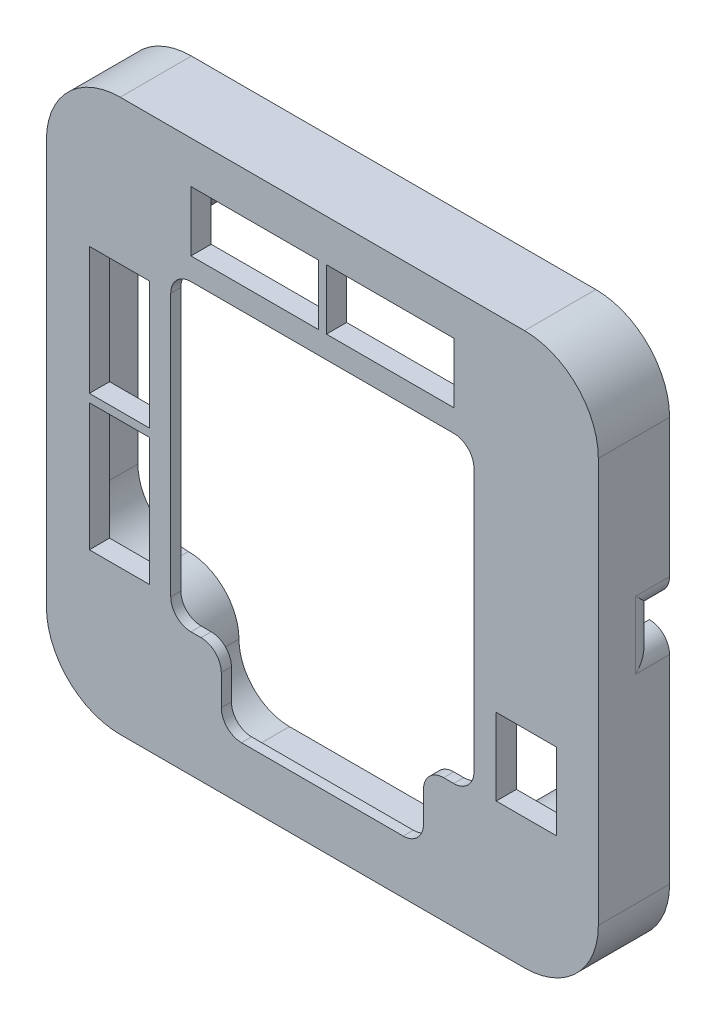
from build123d import *

# Parameters (mm, degrees)
WALL_EXTRUDE_BOSS_START          = 8.64
WALL_EXTRUDE_BOSS_DEPTH          = 7.05
CEILING_EXTRUDE_BOSS_DEPTH       = 2
SCREWS_BLOCKS_EXTRUDE_BOSS_DEPTH = 5.05
SCREWS_BLOCKS_FILLET_R           = 5
NUTS_EXTRUDE_DEPTH               = 3.2
SCREWS_SKETCH_R                  = 2.15
SCREWS_HOOLES_EXTRUDE_DEPTH      = 2.5
CONNECTORS_SKETCH_W              = 12.6
CONNECTORS_SKETCH_H              = 5.95
CONNECTORS_SKETCH_W_2            = 5.95
CONNECTORS_SKETCH_H_2            = 12.6
CONNECTORS_SKETCH_H_3            = 7.6
CONNECTORS_EXTRUDE_DEPTH         = 2.5
SWITCH_SKETCH_W                  = 1.4
SWITCH_SKETCH_H                  = 2.68
SWITCH_EXTRUDE_DEPTH             = 2.5
SWITCH_FILLET_R                  = 2
GLASS_EXTRUDE_DEPTH              = 2.5
GLASS_FIT_EXTRUDE_DEPTH          = 1


with BuildPart() as part:
    # Wall_Sketch → Wall_Extrude_Boss (new body)
    with BuildSketch(Plane.XY.offset(WALL_EXTRUDE_BOSS_START)):
        with BuildLine():
            Line((-52.3, 44.999999897), (-52.29999, 5.00000605))
            ThreePointArc((-52.29999, 5.00000605), (-50.161874571, -0.161870293), (-45, -2.29999))
            Line((-45, -2.29999), (-5.000000575, -2.3))
            ThreePointArc((-5.000000575, -2.3), (0.161879299, -0.161879706), (2.3, 5))
            Line((2.3, 5), (2.3, 45))
            ThreePointArc((2.3, 45), (0.161879503, 50.161879503), (-5, 52.3))
            Line((-5, 52.3), (-45, 52.3))
            ThreePointArc((-45, 52.3), (-50.161879539, 50.161879466), (-52.3, 44.999999897))
        make_face()
        with BuildLine():
            Line((-5, 50.3), (-45, 50.3))
            ThreePointArc((-45, 50.3), (-48.747665967, 48.747665914), (-50.3, 44.999999925))
            Line((-50.3, 44.999999925), (-50.29999, 5.00000655))
            ThreePointArc((-50.29999, 5.00000655), (-48.747661185, 1.252343447), (-45, -0.29999))
            Line((-45, -0.29999), (-5.000000075, -0.3))
            ThreePointArc((-5.000000075, -0.3), (-1.252334086, 1.252334033), (0.3, 5))
            Line((0.3, 5), (0.3, 45))
            ThreePointArc((0.3, 45), (-1.25233406, 48.74766594), (-5, 50.3))
        make_face(mode=Mode.SUBTRACT)
    extrude(amount=-WALL_EXTRUDE_BOSS_DEPTH)

    # Ceiling_Sketch → Ceiling_Extrude_Boss (add)
    with BuildSketch(Plane.XY.offset(8.64)):
        with BuildLine():
            Line((-45, -0.29999), (-5.000000075, -0.3))
            ThreePointArc((-5.000000075, -0.3), (-1.252334086, 1.252334033), (0.3, 5))
            Line((0.3, 5), (0.3, 45))
            ThreePointArc((0.3, 45), (-1.25233406, 48.74766594), (-5, 50.3))
            Line((-5, 50.3), (-45, 50.3))
            ThreePointArc((-45, 50.3), (-48.747665967, 48.747665914), (-50.3, 44.999999925))
            Line((-50.3, 44.999999925), (-50.29999, 5.00000655))
            ThreePointArc((-50.29999, 5.00000655), (-48.747661185, 1.252343447), (-45, -0.29999))
        make_face()
    extrude(amount=-CEILING_EXTRUDE_BOSS_DEPTH)


with BuildPart() as screws_blocks_extrude_boss_tool:
    # Screws_Blocks_Sketch → Screws_Blocks_Extrude_Boss (new body)
    with BuildSketch(Plane(origin=(0, 0, 6.64), x_dir=(-1, 0, 0), z_dir=(0, 0, -1))):
        with BuildLine():
            Line((9.7, -0.299998825), (4.7, -0.299998825))
            ThreePointArc((4.7, -0.299998825), (1.164466094, 1.164467269), (-0.3, 4.700001175))
            Line((-0.3, 4.700001175), (-0.3, 9.700001175))
            Line((-0.3, 9.700001175), (9.7, 9.700001175))
            Line((9.7, 9.700001175), (9.7, -0.299998825))
        make_face()
        with BuildLine():
            Line((9.7, 50.3), (4.7, 50.3))
            ThreePointArc((4.7, 50.3), (1.164466094, 48.835533906), (-0.3, 45.3))
            Line((-0.3, 45.3), (-0.3, 40.3))
            Line((-0.3, 40.3), (9.7, 40.3))
            Line((9.7, 40.3), (9.7, 50.3))
        make_face()
        with BuildLine():
            Line((40.299998825, 50.3), (45.299998825, 50.3))
            ThreePointArc((45.299998825, 50.3), (48.835532731, 48.835533906), (50.299998825, 45.3))
            Line((50.299998825, 45.3), (50.299998825, 40.3))
            Line((50.299998825, 40.3), (40.299998825, 40.3))
            Line((40.299998825, 40.3), (40.299998825, 50.3))
        make_face()
        with BuildLine():
            Line((40.299991175, -0.299991175), (45.299991175, -0.299991175))
            ThreePointArc((45.299991175, -0.299991175), (48.835525081, 1.164474919), (50.299991175, 4.700008825))
            Line((50.299991175, 4.700008825), (50.299991175, 9.700008825))
            Line((50.299991175, 9.700008825), (40.299991175, 9.700008825))
            Line((40.299991175, 9.700008825), (40.299991175, -0.299991175))
        make_face()
    extrude(amount=SCREWS_BLOCKS_EXTRUDE_BOSS_DEPTH)


with BuildPart() as part_1:
    add(part.part)


with BuildPart() as part_2:
    # Screws_Blocks_Extrude_Boss: joined with screws_blocks_extrude_boss_tool
    add(part_1.part.fuse(screws_blocks_extrude_boss_tool.part, tol=0.00001))

    # Screws_Blocks_Fillet
    screws_blocks_fillet_edges = [part_2.edges().sort_by_distance(p)[0] for p in [
        (-40.299998825, 50.3, 4.115),
        (-50.299998825, 40.3, 4.115),
        (-40.299998825, 40.3, 4.115),
        (-9.7, 50.3, 4.115),
        (-9.7, 40.3, 4.115),
        (0.3, 40.3, 4.115),
        (0.3, 9.700001175, 4.115),
        (-9.7, 9.700001175, 4.115),
        (-9.7, -0.299998825, 4.115),
        (-40.299991175, -0.299991175, 4.115),
        (-40.299991175, 9.700008825, 4.115),
        (-50.299991175, 9.700008825, 4.115),
    ]]
    fillet(screws_blocks_fillet_edges, radius=SCREWS_BLOCKS_FILLET_R - 0.0001)  # a hair under: the kernel refuses the full size

    # Nuts_Sketch → Nuts_Extrude (cut)
    with BuildSketch(Plane(origin=(0, 0, 1.59), x_dir=(-1, 0, 0), z_dir=(0, 0, -1))):
        Polygon((1.500002453, 44.995856332), (3.253589748, 41.966841377), (6.753587296, 41.970985045), (8.499997547, 45.004143668), (6.746410252, 48.033158623), (3.246412704, 48.029014955), align=None)
        Polygon((41.5, 45), (43.25, 41.968911087), (46.75, 41.968911087), (48.5, 45), (46.75, 48.031088913), (43.25, 48.031088913), align=None)
        Polygon((41.5, 5), (43.25, 1.968911087), (46.75, 1.968911087), (48.5, 5), (46.75, 8.031088913), (43.25, 8.031088913), align=None)
        Polygon((8.49998026, 4.988245077), (6.760170192, 8.025194356), (3.260189932, 8.03694928), (1.50001974, 5.011754923), (3.239829808, 1.974805644), (6.739810068, 1.96305072), align=None)
    extrude(amount=-NUTS_EXTRUDE_DEPTH, mode=Mode.SUBTRACT)

    # Screws_Sketch → Screws_Hooles_Extrude (cut)
    with BuildSketch(Plane(origin=(0, 0, 4.79), x_dir=(-1, 0, 0), z_dir=(0, 0, -1))):
        with Locations((5, 45)):
            Circle(SCREWS_SKETCH_R)
        with Locations((45, 45)):
            Circle(SCREWS_SKETCH_R)
        with Locations((45, 5)):
            Circle(SCREWS_SKETCH_R)
        with Locations((5, 5)):
            Circle(SCREWS_SKETCH_R)
    extrude(amount=-SCREWS_HOOLES_EXTRUDE_DEPTH, mode=Mode.SUBTRACT)

    # Connectors_Sketch → Connectors_Extrude (cut)
    with BuildSketch(Plane.XY.offset(8.64)):
        with Locations((-31.7, 45.175)):
            Rectangle(CONNECTORS_SKETCH_W, CONNECTORS_SKETCH_H)
        with Locations((-18.3, 45.175)):
            Rectangle(CONNECTORS_SKETCH_W, CONNECTORS_SKETCH_H)
        with Locations((-45.075, 31.7)):
            Rectangle(CONNECTORS_SKETCH_W_2, CONNECTORS_SKETCH_H_2)
        with Locations((-45.075, 18.3)):
            Rectangle(CONNECTORS_SKETCH_W_2, CONNECTORS_SKETCH_H_2)
        with Locations((-4.825, 14.4)):
            Rectangle(CONNECTORS_SKETCH_W_2, CONNECTORS_SKETCH_H_3)
    extrude(amount=-CONNECTORS_EXTRUDE_DEPTH, mode=Mode.SUBTRACT)

    # Switch_Sketch → Switch_Extrude (cut)
    with BuildSketch(Plane(origin=(2.3, 0, 0), x_dir=(0, 0, -1), z_dir=(1, 0, 0))):
        with Locations((-2.24, 28.01)):
            Rectangle(SWITCH_SKETCH_W, SWITCH_SKETCH_H)
    extrude(amount=-SWITCH_EXTRUDE_DEPTH, mode=Mode.SUBTRACT)

    # Switch_Fillet
    switch_fillet_edges = [part_2.edges().sort_by_distance(p)[0] for p in [
        (2.3, 28.01, 2.94),
        (2.3, 29.35, 2.265),
        (2.3, 26.67, 2.265),
    ]]
    fillet(switch_fillet_edges, radius=SWITCH_FILLET_R - 0.0001)  # a hair under: the kernel refuses the full size

    # Glass_Sketch → Glass_Extrude (cut)
    with BuildSketch(Plane(origin=(0, 0, 6.64), x_dir=(-1, 0, 0), z_dir=(0, 0, -1))):
        with BuildLine():
            Line((34.9999975, 8), (34.9999975, 5))
            ThreePointArc((34.9999975, 5), (34.414211062, 3.585786438), (32.9999975, 3))
            Line((32.9999975, 3), (16.9999975, 3))
            ThreePointArc((16.9999975, 3), (15.585783938, 3.585786438), (14.9999975, 5))
            Line((14.9999975, 5), (14.9999975, 8))
            ThreePointArc((14.9999975, 8), (14.414211062, 9.414213562), (12.9999975, 10))
            Line((12.9999975, 10), (11.9999975, 10))
            ThreePointArc((11.9999975, 10), (10.585783938, 10.585786438), (9.9999975, 12))
            Line((9.9999975, 12), (9.9999975, 38))
            ThreePointArc((9.9999975, 38), (10.585783938, 39.414213562), (11.9999975, 40))
            Line((11.9999975, 40), (37.9999975, 40))
            ThreePointArc((37.9999975, 40), (39.414211062, 39.414213562), (39.9999975, 38))
            Line((39.9999975, 38), (39.9999975, 12))
            ThreePointArc((39.9999975, 12), (39.414211062, 10.585786438), (37.9999975, 10))
            Line((37.9999975, 10), (36.9999975, 10))
            ThreePointArc((36.9999975, 10), (35.585783938, 9.414213562), (34.9999975, 8))
        make_face()
    extrude(amount=-GLASS_EXTRUDE_DEPTH, mode=Mode.SUBTRACT)

    # Glass_Fit_Sketch → Glass_Fit_Extrude (cut)
    with BuildSketch(Plane(origin=(0, 0, 6.64), x_dir=(-1, 0, 0), z_dir=(0, 0, -1))):
        with BuildLine():
            Line((36.9999975, 8.5), (37.9999975, 8.5))
            ThreePointArc((37.9999975, 8.5), (40.474871234, 9.525126266), (41.4999975, 12))
            Line((41.4999975, 12), (41.4999975, 38))
            ThreePointArc((41.4999975, 38), (40.474871234, 40.474873734), (37.9999975, 41.5))
            Line((37.9999975, 41.5), (11.9999975, 41.5))
            ThreePointArc((11.9999975, 41.5), (9.525123766, 40.474873734), (8.4999975, 38))
            Line((8.4999975, 38), (8.4999975, 12))
            ThreePointArc((8.4999975, 12), (9.525123766, 9.525126266), (11.9999975, 8.5))
            Line((11.9999975, 8.5), (12.9999975, 8.5))
            ThreePointArc((12.9999975, 8.5), (13.353550891, 8.353553391), (13.4999975, 8))
            Line((13.4999975, 8), (13.4999975, 5))
            ThreePointArc((13.4999975, 5), (14.525123766, 2.525126266), (16.9999975, 1.5))
            Line((16.9999975, 1.5), (32.9999975, 1.5))
            ThreePointArc((32.9999975, 1.5), (35.474871234, 2.525126266), (36.4999975, 5))
            Line((36.4999975, 5), (36.4999975, 8))
            ThreePointArc((36.4999975, 8), (36.646444109, 8.353553391), (36.9999975, 8.5))
        make_face()
    extrude(amount=-GLASS_FIT_EXTRUDE_DEPTH, mode=Mode.SUBTRACT)


solid = part_2.part
